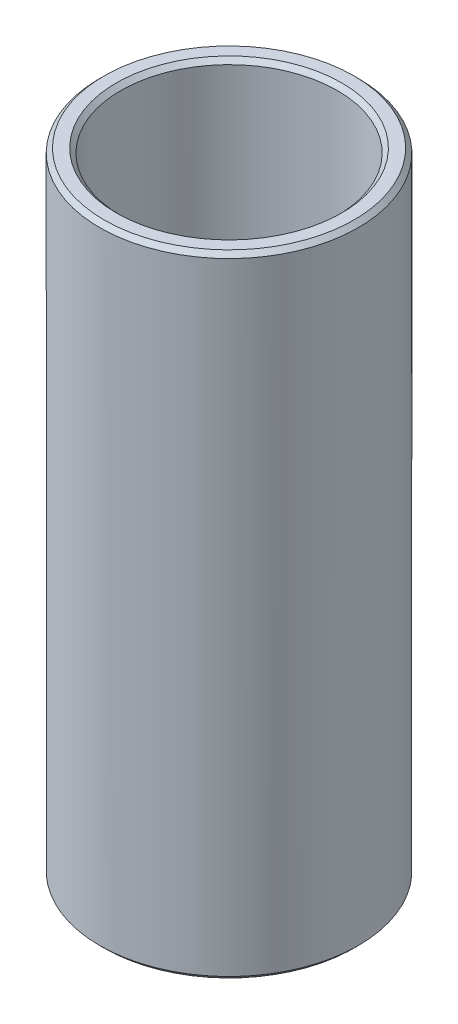
from build123d import *

# Parameters (mm, degrees)
SKETCH1_R           = 47.5
BOSS_EXTRUDE1_DEPTH = 231.668085066
SKETCH2_R           = 39.782528078
CUT_EXTRUDE1_DEPTH  = 242.210699676
CHAMFER1_SIZE       = 1.624303227


with BuildPart() as part:
    # Sketch1 → Boss-Extrude1 (new body)
    with BuildSketch(Plane(origin=(0, 0, 0), x_dir=(1, 0, 0), z_dir=(0, 1, 0))):
        Circle(SKETCH1_R)
    extrude(amount=BOSS_EXTRUDE1_DEPTH)

    # Sketch2 → Cut-Extrude1 (cut, through all)
    with BuildSketch(Plane(origin=(0, 0, 0), x_dir=(1, 0, 0), z_dir=(0, 1, 0))):
        Circle(SKETCH2_R)
    extrude(amount=CUT_EXTRUDE1_DEPTH, mode=Mode.SUBTRACT)

    # Chamfer1
    chamfer1_edges = [part.edges().sort_by_distance(p)[0] for p in [
        (-39.782528078, 231.668085066, 0),
        (-39.782528078, 0, 0),
        (-47.5, 0, 0),
        (-47.5, 231.668085066, 0),
    ]]
    chamfer(chamfer1_edges, length=CHAMFER1_SIZE)


solid = part.part
